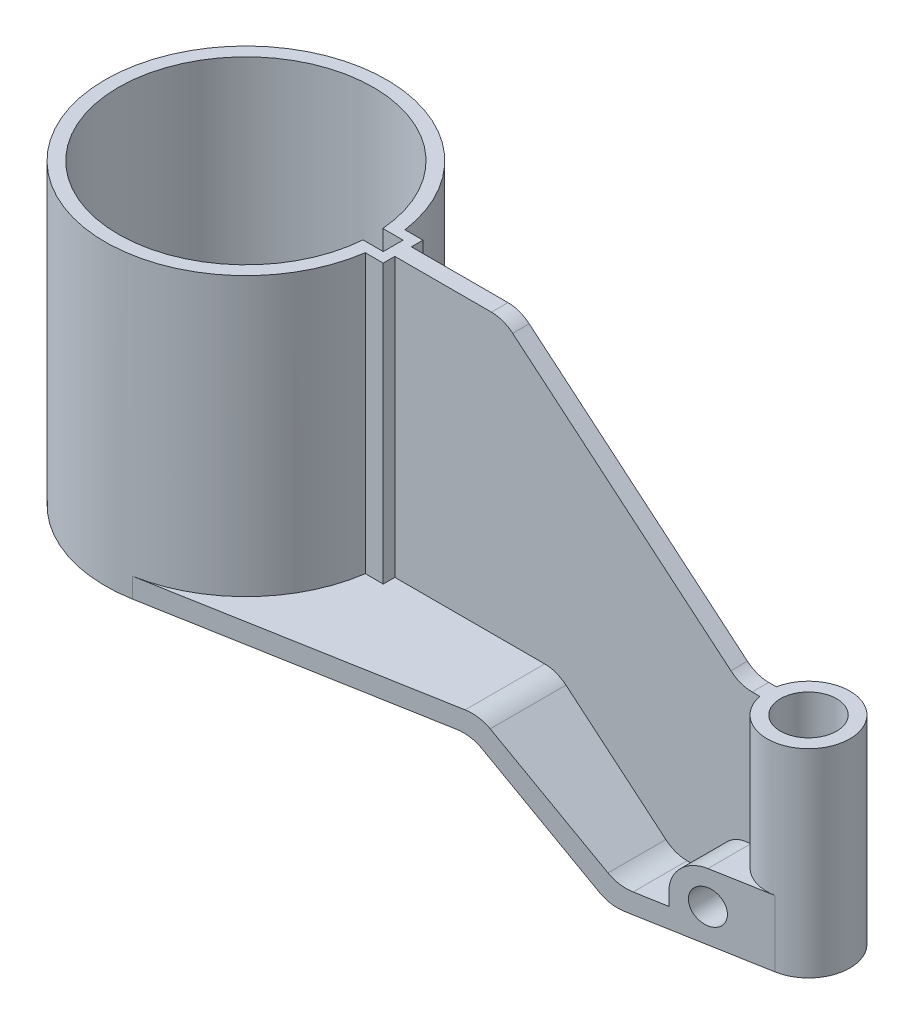
from build123d import *

# Parameters (mm, degrees)
BOSS_EXTRUDE1_DEPTH     = 90
BOSS_EXTRUDE2_START     = -30
SKETCH2_3_R             = 12.5
BOSS_EXTRUDE2_DEPTH     = 60
EXTRUDE_THIN1_DEPTH     = 115
SKETCH5_W               = 50
SKETCH5_H               = 20
BOSS_EXTRUDE3_DEPTH     = 230
CUT_EXTRUDE2_DEPTH      = 315.682379551
CUT_EXTRUDE2_DEPTH_BACK = 315.682379551
SKETCH5_3_R             = 5
CUT_EXTRUDE1_START      = -30
CUT_EXTRUDE1_OUTLINE_R  = 8.5
CUT_EXTRUDE1_DEPTH      = 120
RIB1_START              = -2.5
RIB1_DEPTH              = 5
FILLET1_R               = 10


# Read off the part's stored shape, not the designer's step: Cut-Extrude1, Rib1
with BuildPart() as part:
    # Sketch2 → Boss-Extrude1 (new body)
    with BuildSketch(Plane(origin=(0, 0, 0), x_dir=(1, 0, 0), z_dir=(0, 1, 0))):
        with BuildLine():
            Line((42.074338973, 6), (47.5, 6))
            Line((47.5, 6), (47.5, -6))
            Line((47.5, -6), (42.074338973, -6))
            ThreePointArc((42.074338973, -6), (-42.5, 0), (42.074338973, 6))
        make_face()
    extrude(amount=BOSS_EXTRUDE1_DEPTH)



with BuildPart() as body_2:
    # Sketch2<3> → Boss-Extrude2 (new body)
    with BuildSketch(Plane(origin=(0, 0, 0), x_dir=(1, 0, 0), z_dir=(0, 1, 0)).offset(BOSS_EXTRUDE2_START)):
        with Locations(Location((170, 0, 0), (0, 0, 270))):
            Circle(SKETCH2_3_R)
    extrude(amount=BOSS_EXTRUDE2_DEPTH)


with BuildPart() as part_1:
    add(part.part)

    add(body_2.part)  # Extrude-Thin1 merges body 2
    # Sketch3 → Extrude-Thin1 (add, symmetric)
    with BuildSketch(Plane.XY):
        Polygon((-42.5, 0), (94.247392222, 0), (130, -30), (182.5, -30), (182.5, -24), (132.183821406, -24), (96.431213628, 6), (-42.5, 6), align=None)
    extrude(amount=EXTRUDE_THIN1_DEPTH, both=True)

    # Sketch5 → Boss-Extrude3 (add)
    with BuildSketch(Plane.XY.offset(115)):
        with Locations((170, -20)):
            Rectangle(SKETCH5_W, SKETCH5_H)
    extrude(amount=-BOSS_EXTRUDE3_DEPTH)

    # Sketch5<3> → Cut-Extrude2 (cut, two sides: drawn at the far end of the back side and taken through both)
    with BuildSketch(Plane.XY.offset(115).offset(-CUT_EXTRUDE2_DEPTH_BACK)):
        with Locations((155, -20)):
            Circle(SKETCH5_3_R)
    extrude(amount=CUT_EXTRUDE2_DEPTH + CUT_EXTRUDE2_DEPTH_BACK, mode=Mode.SUBTRACT)

    # Cut-Extrude1 outline → Cut-Extrude1 (cut)
    with BuildSketch(Plane(origin=(0, 0, 0), x_dir=(1, 0, 0), z_dir=(0, 1, 0)).offset(CUT_EXTRUDE1_START)):
        with BuildLine():
            ThreePointArc((-42.5, 2.03e-07), (-27.271780209, 32.596012091), (7.5, 41.833001327))
            Line((7.5, 41.833001327), (145, 17.181411259))
            Line((145, 17.181411259), (145, 115))
            Line((145, 115), (-42.5, 115))
            Line((-42.5, 115), (-42.5, 2.03e-07))
        make_face()
        with BuildLine():
            Line((145, 115), (145, 17.181411259))
            Line((145, 17.181411259), (172.205882353, 12.30382392))
            ThreePointArc((172.205882353, 12.30382392), (179.587062361, 8.021111849), (182.5, 0))
            ThreePointArc((182.5, 0), (179.587062361, -8.021111849), (172.205882353, -12.30382392))
            Line((172.205882353, -12.30382392), (145, -17.181411259))
            Line((145, -17.181411259), (145, -115))
            Line((145, -115), (195, -115))
            Line((195, -115), (195, 115))
            Line((195, 115), (145, 115))
        make_face()
        with BuildLine():
            ThreePointArc((7.5, -41.833001327), (-27.271780365, -32.596011961), (-42.5, 2.03e-07))
            Line((-42.5, 2.03e-07), (-42.5, -115))
            Line((-42.5, -115), (145, -115))
            Line((145, -115), (145, -17.181411259))
            Line((145, -17.181411259), (7.5, -41.833001327))
        make_face()
        with BuildLine():
            Line((44.5, 3), (38.382938918, 3))
            ThreePointArc((38.382938918, 3), (-38.5, 0), (38.382938918, -3))
            Line((38.382938918, -3), (44.5, -3))
            Line((44.5, -3), (44.5, 3))
        make_face()
        with Locations((170, 0)):
            Circle(CUT_EXTRUDE1_OUTLINE_R)
    extrude(amount=CUT_EXTRUDE1_DEPTH, mode=Mode.SUBTRACT)

    # Rib1 outline → Rib1 (add)
    with BuildSketch(Plane.XY.offset(RIB1_START)):
        Polygon((151.838214056, 30), (80.3329985, 90), (47.5, 90), (47.5, 6), (96.431213628, 6), (132.183821406, -24), (145, -24), (145, -10), (159, -10), (159, 30), align=None)
    extrude(amount=RIB1_DEPTH)

    # Fillet1
    fillet1_edges = [part_1.edges().sort_by_distance(p)[0] for p in [
        (145, -10, 9.84070563),
        (132.183821406, -24, -10.989575378),
        (96.431213628, 6, -14.194515854),
        (151.838214056, 30, 0),
        (80.3329985, 90, 0),
        (145, -10, -9.84070563),
        (94.247392222, 0, 0),
        (96.431213628, 6, 14.194515854),
        (132.183821406, -24, 10.989575378),
        (130, -30, 0),
    ]]
    fillet(fillet1_edges, radius=FILLET1_R)


solid = part_1.part
